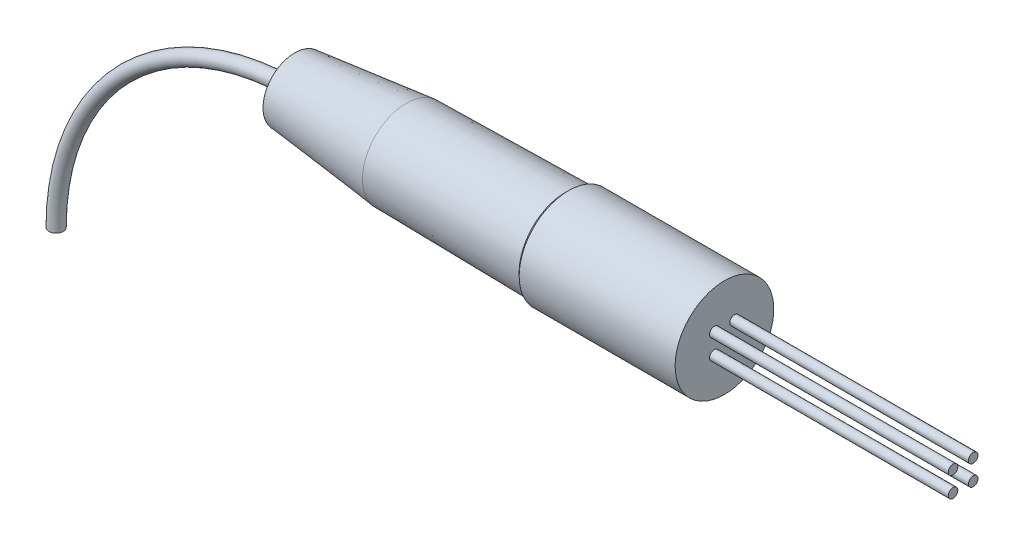
from build123d import *

# Parameters (mm, degrees)
CHAMFER_1_SIZE  = 0.2
SKETCH_4_R      = 0.45
SKETCH_5_R      = 0.3
EXTRUDE_2_DEPTH = 15


with BuildPart() as part:
    # 旋转2: read off the stored shape, not the designer's step
    # 旋转2 outline → 旋转2 (revolve)
    with BuildSketch(Plane.YX):
        Polygon((3.1, 0), (0, 0), (0, -27), (2, -27), (2.75, -20), (2.9, -10), (3.1, -10), align=None)
    revolve(axis=Axis((0, 0, 0), (1, 0, 0)))

    # 倒角1
    chamfer_1_edges = [part.edges().sort_by_distance(p)[0] for p in [
        (-10, -3.1, 0),
    ]]
    chamfer(chamfer_1_edges, length=CHAMFER_1_SIZE - 0.0001)  # a hair under: the kernel refuses the full size

    # 扫描1: sweep along a path in 草图3
    with BuildLine(Plane.XY) as sweep_1_path:
        ThreePointArc((-27, 0), (-37.606601718, -4.393398282), (-42, -15))
    # 草图4 → 扫描1 (sweep)
    with BuildSketch(Plane.ZY.offset(27)):
        Circle(SKETCH_4_R)
    sweep(path=sweep_1_path.line)

    # 草图5 → 拉伸2 (add)
    with BuildSketch(Plane(origin=(0, 0, 0), x_dir=(0, 0, -1), z_dir=(1, 0, 0))):
        with Locations(Location((-0.635, 0.635, 0), (0, 0, 270))):
            Circle(SKETCH_5_R)
        with Locations(Location((-0.635, -0.635, 0), (0, 0, 270))):
            Circle(SKETCH_5_R)
        with Locations(Location((0.635, 0.635, 0), (0, 0, 270))):
            Circle(SKETCH_5_R)
        with Locations(Location((0.635, -0.635, 0), (0, 0, 270))):
            Circle(SKETCH_5_R)
    extrude(amount=EXTRUDE_2_DEPTH)


solid = part.part
